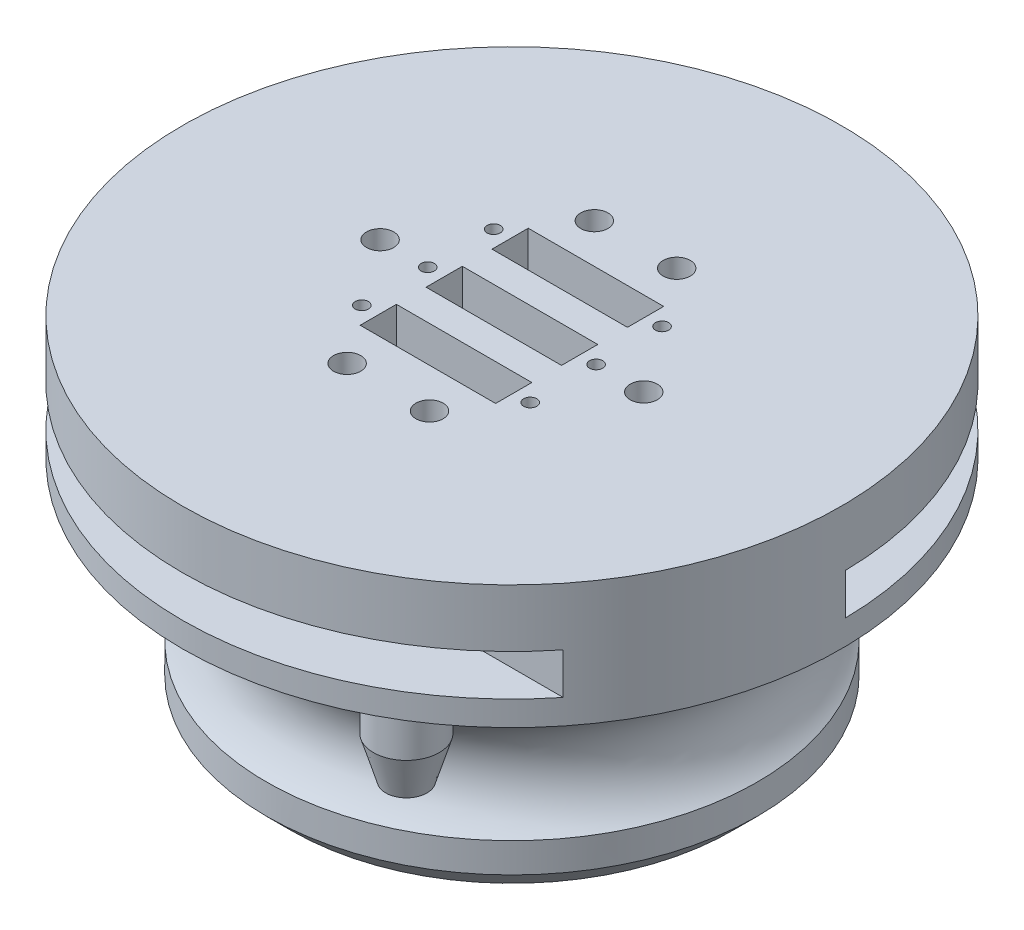
from build123d import *

# Parameters (mm, degrees)
SKETCH1_R               = 29.8
SKETCH1_R_2             = 20.2
BOSS_EXTRUDE1_DEPTH     = 25.7
SKETCH3_R               = 40
BOSS_EXTRUDE2_DEPTH     = 15
SKETCH4_R               = 4
BOSS_EXTRUDE3_DEPTH     = 5
SKETCH6_R               = 2.5
CUT_EXTRUDE1_START      = -12
CUT_EXTRUDE1_DEPTH      = 5
CUT_EXTRUDE5_REACH      = 108.189
CUT_EXTRUDE5_END_RADIUS = 40
CUT_EXTRUDE5_START      = -36.5
SKETCH13_R              = 2.625
CUT_EXTRUDE6_DEPTH      = 3.2
SKETCH15_W              = 16.44
SKETCH15_H              = 4.4
CUT_EXTRUDE7_DEPTH      = 63.132841686
SKETCH16_R              = 0.8
CUT_EXTRUDE8_DEPTH      = 64.523302937
SKETCH17_R              = 2.75
SKETCH17_R_2            = 1.65
CUT_EXTRUDE9_DEPTH      = 5
SKETCH17_3_R            = 1.65
CUT_EXTRUDE10_DEPTH     = 63.132841686


with BuildPart() as part:
    # Sketch1 → Boss-Extrude1 (new body)
    with BuildSketch(Plane(origin=(0, 0, 0), x_dir=(1, 0, 0), z_dir=(0, 1, 0))):
        with Locations(Location((0, 0, 0), (0, 0, 90))):
            Circle(SKETCH1_R)
        with Locations(Location((0, 0, 0), (0, 0, 90))):
            Circle(SKETCH1_R_2, mode=Mode.SUBTRACT)
    extrude(amount=BOSS_EXTRUDE1_DEPTH)

    # Sketch2 → Cut-Revolve1 (revolve, cut)
    with BuildSketch(Plane.XY, mode=Mode.PRIVATE) as cut_revolve1_sk:
        with BuildLine():
            Line((29.8, 12.7), (29.8, 18.799180273))
            ThreePointArc((29.8, 18.799180273), (27.590586132, 16.098529094), (26.8, 12.7))
            Line((26.8, 12.7), (29.8, 12.7))
        make_face()
        with BuildLine():
            Line((29.8, 6.600819727), (29.8, 12.7))
            Line((29.8, 12.7), (26.8, 12.7))
            ThreePointArc((26.8, 12.7), (27.590586132, 9.301470906), (29.8, 6.600819727))
        make_face()
        Polygon((29.8, 3), (26.8, 0), (29.8, 0), align=None)
    revolve(cut_revolve1_sk.sketch.rotate(Axis((0, 25.7, 0), (0, -1, 0)), 270), axis=Axis((0, 25.7, 0), (0, -1, 0)), mode=Mode.SUBTRACT)

    # Sketch3 → Boss-Extrude2 (add)
    with BuildSketch(Plane(origin=(0, 25.7, 0), x_dir=(1, 0, 0), z_dir=(0, 1, 0))):
        with Locations(Location((0, 0, 0), (0, 0, 270))):
            Circle(SKETCH3_R)
    extrude(amount=BOSS_EXTRUDE2_DEPTH)

    # Sketch4 → Boss-Extrude3 (add)
    with BuildSketch(Plane(origin=(0, 25.7, 0), x_dir=(-1, 0, 0), z_dir=(0, -1, 0))):
        with Locations(Location((-17.5, -30.310889132, 0), (0, 0, 270))):
            Circle(SKETCH4_R)
        with Locations(Location((32.889241728, -11.970705016, 0), (0, 0, 270))):
            Circle(SKETCH4_R)
        with Locations(Location((-6.077686218, 34.468271355, 0), (0, 0, 270))):
            Circle(SKETCH4_R)
    extrude(amount=BOSS_EXTRUDE3_DEPTH)

    # Sketch6 → section 1 of loft1
    with BuildSketch(Plane(origin=(0, 15.7, 0), x_dir=(-1, 0, 0), z_dir=(0, -1, 0)), mode=Mode.PRIVATE) as loft1_s1:
        with Locations((32.889241728, -11.970705016)):
            Circle(SKETCH6_R)
    # loft from a face of the part (loft1)
    loft([part.faces().sort_by_distance((-32.889241728, 20.7, 11.970705016))[0], loft1_s1.sketch])

    # Boundary1: read off the stored shape, not the designer's step
    # Boundary1 outline → Boundary1 (revolve)
    with BuildSketch(Plane(origin=(17.5, 0, 30.310889132), x_dir=(1, 0, 0), z_dir=(0, 0, 1))):
        Polygon((0, 20.7), (0, 15.7), (2.5, 15.7), (4, 20.7), align=None)
    revolve(axis=Axis((17.5, 0, 30.310889132), (0, 1, 0)))

    # Boundary2: read off the stored shape, not the designer's step
    # Boundary2: loft between two sections, ruled curve by curve
    boundary2_from = [
        Edge.make_bspline([(9.922742778, 20.7, -33.365756026), (9.778423859, 20.7, -32.862439299), (9.289775651, 20.7, -31.913155977), (8.067478825, 20.7, -30.878607721), (6.542374051, 20.7, -30.390384874), (4.946413374, 20.7, -30.522974824), (3.522746317, 20.7, -31.256212676), (2.488002725, 20.7, -32.478460941), (1.999820352, 20.7, -34.003603594), (2.132382571, 20.7, -35.599531113), (2.865650923, 20.7, -37.023214684), (4.087837179, 20.7, -38.057933438), (5.613033755, 20.7, -38.546155237), (7.208931106, 20.7, -38.413575903), (8.632657493, 20.7, -37.680313497), (9.667322676, 20.7, -36.45811299), (10.155689167, 20.7, -34.933056337), (10.067061697, 20.7, -33.869072752), (9.922742778, 20.7, -33.365756026)], [0, 0, 0, 0, 0.0625, 0.125, 0.1875, 0.25, 0.3125, 0.375, 0.4375, 0.5, 0.5625, 0.625, 0.6875, 0.75, 0.8125, 0.875, 0.9375, 1, 1, 1, 1], 3),
    ]
    boundary2_to = [
        Edge.make_bspline([(8.313438837, 15.7, -33.349606871), (8.167005998, 15.7, -33.056947538), (7.757868808, 15.7, -32.529805617), (6.88811309, 15.7, -32.034506513), (5.895137902, 15.7, -31.909602819), (4.929849468, 15.7, -32.174234081), (4.139348951, 15.7, -32.788112293), (3.643935799, 15.7, -33.657748526), (3.519005287, 15.7, -34.650828768), (3.783658552, 15.7, -35.616093907), (4.397524642, 15.7, -36.406629525), (5.26722668, 15.7, -36.902042852), (6.260254151, 15.7, -37.026934051), (7.225507947, 15.7, -36.762316146), (8.016039922, 15.7, -36.14841822), (8.511411727, 15.7, -35.27881634), (8.63646584, 15.7, -34.285761617), (8.459871676, 15.7, -33.642266205), (8.313438837, 15.7, -33.349606871)], [0, 0, 0, 0, 0.0625, 0.125, 0.1875, 0.25, 0.3125, 0.375, 0.4375, 0.5, 0.5625, 0.625, 0.6875, 0.75, 0.8125, 0.875, 0.9375, 1, 1, 1, 1], 3),
    ]
    boundary2 = Solid(Shell([*[Face.make_surface_from_curves(boundary2_from[k], boundary2_to[k]) for k in range(1)], Face(Wire(boundary2_from)), Face(Wire(boundary2_to))]))
    add(boundary2)

    # Sketch7 → Cut-Extrude1 (cut)
    with BuildSketch(Plane(origin=(0, 40.7, 0), x_dir=(1, 0, 0), z_dir=(0, 1, 0)).offset(CUT_EXTRUDE1_START)):
        with BuildLine():
            ThreePointArc((31.224989992, 25), (0, 40), (-31.224989992, 25))
            Line((-31.224989992, 25), (0, 25))
            Line((0, 25), (31.224989992, 25))
        make_face()
        with BuildLine():
            Line((-5.8e-08, -25), (-31.224989992, -25))
            ThreePointArc((-31.224989992, -25), (0, -40), (31.224989992, -25))
            Line((31.224989992, -25), (-5.8e-08, -25))
        make_face()
        with BuildLine():
            Line((-19.515618745, -15.625), (-31.224989992, -25))
            Line((-31.224989992, -25), (-5.8e-08, -25))
            ThreePointArc((-5.8e-08, -25), (-10.825317574, -22.534695459), (-19.515618745, -15.625))
        make_face()
        with BuildLine():
            Line((-24.998227986, -0.297653397), (-39.997164778, -0.476245435))
            ThreePointArc((-39.997164778, -0.476245435), (-37.663011922, -13.472102025), (-31.224989992, -25))
            Line((-31.224989992, -25), (-19.515618745, -15.625))
            ThreePointArc((-19.515618745, -15.625), (-23.539382451, -8.420063766), (-24.998227986, -0.297653397))
        make_face()
        with BuildLine():
            ThreePointArc((39.997164778, 0.476245435), (37.663011922, 13.472102025), (31.224989992, 25))
            Line((31.224989992, 25), (19.515618745, 15.625))
            ThreePointArc((19.515618745, 15.625), (23.539382451, 8.420063766), (24.998227986, 0.297653397))
            Line((24.998227986, 0.297653397), (39.997164778, 0.476245435))
        make_face()
        with BuildLine():
            Line((31.224989992, 25), (0, 25))
            ThreePointArc((0, 25), (10.825317547, 22.534695472), (19.515618745, 15.625))
            Line((19.515618745, 15.625), (31.224989992, 25))
        make_face()
    extrude(amount=CUT_EXTRUDE1_DEPTH, mode=Mode.SUBTRACT)

    # Cut-Extrude5: up to this cylinder (the profile starts inside it)
    cut_extrude5_end = Plane(origin=(0, 31.2, 0), z_dir=(0, -1, 0)) * Cylinder(CUT_EXTRUDE5_END_RADIUS, 297.378, mode=Mode.PRIVATE)
    # Sketch13 → Cut-Extrude5 (cut, up to the surface)
    with BuildSketch(Plane(origin=(0, 0, 0), x_dir=(0, 1, 0), z_dir=(0.9455185755993168, 0, 0.3255681544571571)).offset(CUT_EXTRUDE5_START), mode=Mode.PRIVATE) as cut_extrude5_sk1:
        with Locations(Location((31.2, 0, 0), (0, 0, 270))):
            Circle(SKETCH13_R)
    cut_extrude5_tool1 = extrude(cut_extrude5_sk1.sketch, amount=-CUT_EXTRUDE5_REACH, mode=Mode.PRIVATE) & cut_extrude5_end
    add(cut_extrude5_tool1.solids().sort_by_distance((-34.511428, 31.2, -11.883238))[0], mode=Mode.SUBTRACT)

    # Sketch14 → Cut-Extrude6 (cut)
    with BuildSketch(Plane(origin=(0, 25.7, 0), x_dir=(-1, 0, 0), z_dir=(0, -1, 0))):
        with BuildLine():
            Line((10.22, -2.2), (-10.22, -2.2))
            ThreePointArc((-10.22, -2.2), (-12.42, 0), (-10.22, 2.2))
            Line((-10.22, 2.2), (10.22, 2.2))
            ThreePointArc((10.22, 2.2), (12.42, 0), (10.22, -2.2))
        make_face()
        with BuildLine():
            Line((10.22, 10.2), (-10.22, 10.2))
            ThreePointArc((-10.22, 10.2), (-12.42, 8), (-10.22, 5.8))
            Line((-10.22, 5.8), (10.22, 5.8))
            ThreePointArc((10.22, 5.8), (12.42, 8), (10.22, 10.2))
        make_face()
        with BuildLine():
            Line((10.22, -5.8), (-10.22, -5.8))
            ThreePointArc((-10.22, -5.8), (-12.42, -8), (-10.22, -10.2))
            Line((-10.22, -10.2), (10.22, -10.2))
            ThreePointArc((10.22, -10.2), (12.42, -8), (10.22, -5.8))
        make_face()
    extrude(amount=-CUT_EXTRUDE6_DEPTH, mode=Mode.SUBTRACT)

    # Sketch15 → Cut-Extrude7 (cut, through all)
    with BuildSketch(Plane(origin=(0, 25.7, 0), x_dir=(-1, 0, 0), z_dir=(0, -1, 0))):
        Rectangle(SKETCH15_W, SKETCH15_H)
        with Locations((0, -8)):
            Rectangle(SKETCH15_W, SKETCH15_H)
        with Locations((0, 8)):
            Rectangle(SKETCH15_W, SKETCH15_H)
    extrude(amount=-CUT_EXTRUDE7_DEPTH, mode=Mode.SUBTRACT)

    # Sketch16 → Cut-Extrude8 (cut, through all)
    with BuildSketch(Plane(origin=(0, 28.9, 0), x_dir=(-1, 0, 0), z_dir=(0, -1, 0))):
        with Locations(Location((-10.22, -8, 0), (0, 0, 90))):
            Circle(SKETCH16_R)
        with Locations(Location((-10.22, 0, 0), (0, 0, 90))):
            Circle(SKETCH16_R)
        with Locations(Location((-10.22, 8, 0), (0, 0, 90))):
            Circle(SKETCH16_R)
        with Locations(Location((10.22, -8, 0), (0, 0, 90))):
            Circle(SKETCH16_R)
        with Locations(Location((10.22, 0, 0), (0, 0, 90))):
            Circle(SKETCH16_R)
        with Locations(Location((10.22, 8, 0), (0, 0, 90))):
            Circle(SKETCH16_R)
    extrude(amount=-CUT_EXTRUDE8_DEPTH, mode=Mode.SUBTRACT)

    # Sketch17 → Cut-Extrude9 (cut)
    # profile 1 of 12: a face of its own
    with BuildSketch(Plane(origin=(0, 25.7, 0), x_dir=(-1, 0, 0), z_dir=(0, -1, 0))):
        with Locations(Location((-16, 0, 0), (0, 0, 90))):
            Circle(SKETCH17_R)
        with Locations((-16, 0)):
            Circle(SKETCH17_R_2, mode=Mode.SUBTRACT)
    # profile 2 of 12: a face of its own
    with BuildSketch(Plane(origin=(0, 25.7, 0), x_dir=(-1, 0, 0), z_dir=(0, -1, 0))):
        with Locations((-16, 0)):
            Circle(SKETCH17_R_2)
    # profile 3 of 12: a face of its own
    with BuildSketch(Plane(origin=(0, 25.7, 0), x_dir=(-1, 0, 0), z_dir=(0, -1, 0))):
        with Locations(Location((-5, 15, 0), (0, 0, 90))):
            Circle(SKETCH17_R)
        with Locations((-5, 15)):
            Circle(SKETCH17_R_2, mode=Mode.SUBTRACT)
    # profile 4 of 12: a face of its own
    with BuildSketch(Plane(origin=(0, 25.7, 0), x_dir=(-1, 0, 0), z_dir=(0, -1, 0))):
        with Locations((-5, 15)):
            Circle(SKETCH17_R_2)
    # profile 5 of 12: a face of its own
    with BuildSketch(Plane(origin=(0, 25.7, 0), x_dir=(-1, 0, 0), z_dir=(0, -1, 0))):
        with Locations(Location((5, 15, 0), (0, 0, 90))):
            Circle(SKETCH17_R)
        with Locations((5, 15)):
            Circle(SKETCH17_R_2, mode=Mode.SUBTRACT)
    # profile 6 of 12: a face of its own
    with BuildSketch(Plane(origin=(0, 25.7, 0), x_dir=(-1, 0, 0), z_dir=(0, -1, 0))):
        with Locations((5, 15)):
            Circle(SKETCH17_R_2)
    # profile 7 of 12: a face of its own
    with BuildSketch(Plane(origin=(0, 25.7, 0), x_dir=(-1, 0, 0), z_dir=(0, -1, 0))):
        with Locations(Location((16, 0, 0), (0, 0, 90))):
            Circle(SKETCH17_R)
        with Locations((16, 0)):
            Circle(SKETCH17_R_2, mode=Mode.SUBTRACT)
    # profile 8 of 12: a face of its own
    with BuildSketch(Plane(origin=(0, 25.7, 0), x_dir=(-1, 0, 0), z_dir=(0, -1, 0))):
        with Locations((16, 0)):
            Circle(SKETCH17_R_2)
    # profile 9 of 12: a face of its own
    with BuildSketch(Plane(origin=(0, 25.7, 0), x_dir=(-1, 0, 0), z_dir=(0, -1, 0))):
        with Locations(Location((5, -15, 0), (0, 0, 90))):
            Circle(SKETCH17_R)
        with Locations((5, -15)):
            Circle(SKETCH17_R_2, mode=Mode.SUBTRACT)
    # profile 10 of 12: a face of its own
    with BuildSketch(Plane(origin=(0, 25.7, 0), x_dir=(-1, 0, 0), z_dir=(0, -1, 0))):
        with Locations((5, -15)):
            Circle(SKETCH17_R_2)
    # profile 11 of 12: a face of its own
    with BuildSketch(Plane(origin=(0, 25.7, 0), x_dir=(-1, 0, 0), z_dir=(0, -1, 0))):
        with Locations(Location((-5, -15, 0), (0, 0, 90))):
            Circle(SKETCH17_R)
        with Locations((-5, -15)):
            Circle(SKETCH17_R_2, mode=Mode.SUBTRACT)
    # profile 12 of 12: a face of its own
    with BuildSketch(Plane(origin=(0, 25.7, 0), x_dir=(-1, 0, 0), z_dir=(0, -1, 0))):
        with Locations((-5, -15)):
            Circle(SKETCH17_R_2)
    extrude(amount=-CUT_EXTRUDE9_DEPTH, mode=Mode.SUBTRACT)

    # Sketch17<3> → Cut-Extrude10 (cut, through all)
    with BuildSketch(Plane(origin=(0, 25.7, 0), x_dir=(-1, 0, 0), z_dir=(0, -1, 0))):
        with Locations(Location((-16, 0, 0), (0, 0, 90))):
            Circle(SKETCH17_3_R)
        with Locations(Location((-5, 15, 0), (0, 0, 90))):
            Circle(SKETCH17_3_R)
        with Locations(Location((5, 15, 0), (0, 0, 90))):
            Circle(SKETCH17_3_R)
        with Locations(Location((16, 0, 0), (0, 0, 90))):
            Circle(SKETCH17_3_R)
        with Locations(Location((5, -15, 0), (0, 0, 90))):
            Circle(SKETCH17_3_R)
        with Locations(Location((-5, -15, 0), (0, 0, 90))):
            Circle(SKETCH17_3_R)
    extrude(amount=-CUT_EXTRUDE10_DEPTH, mode=Mode.SUBTRACT)


solid = part.part
